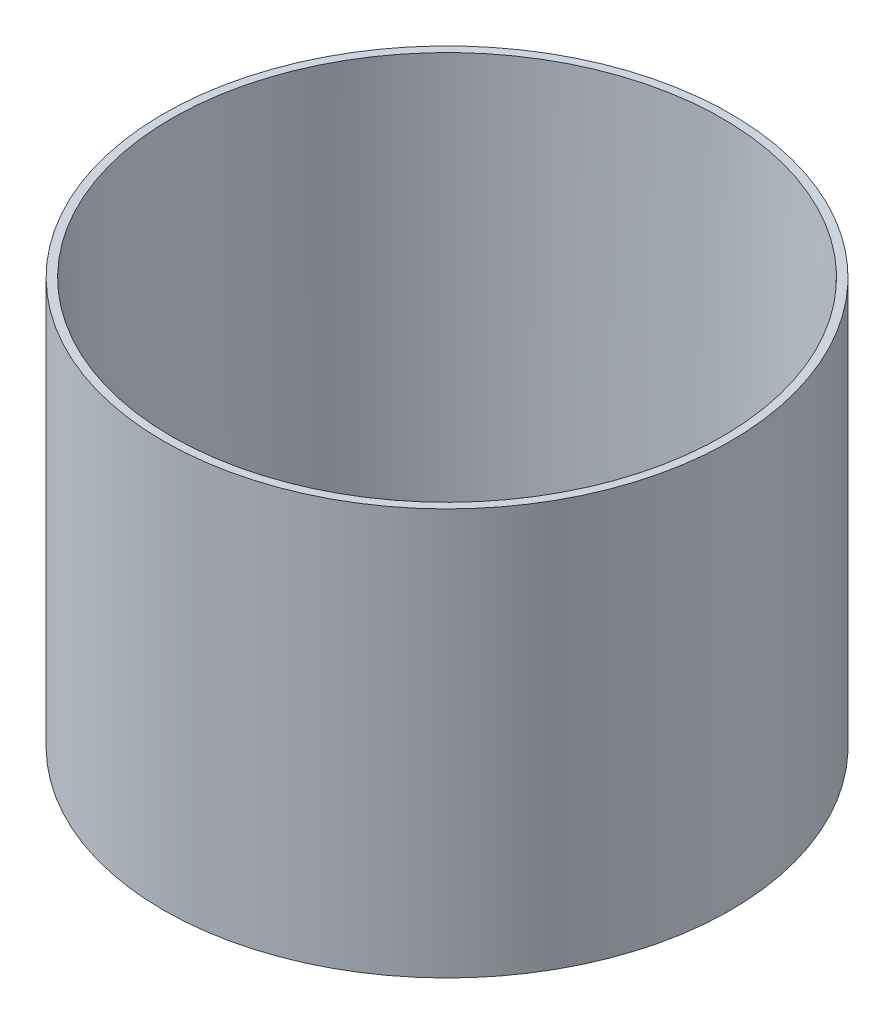
from build123d import *

# Parameters (mm, degrees)
SKETCH1_R           = 17.45
SKETCH1_R_2         = 16.25
BOSS_EXTRUDE1_DEPTH = 25
CHAMFER1_SIZE       = 25
CHAMFER1_SIZE_2     = 0.7


with BuildPart() as part:
    # Sketch1 → Boss-Extrude1 (new body)
    with BuildSketch(Plane(origin=(0, 0, 0), x_dir=(1, 0, 0), z_dir=(0, 1, 0))):
        with Locations(Location((0, 0, 0), (0, 0, 270))):
            Circle(SKETCH1_R)
        with Locations(Location((0, 0, 0), (0, 0, 270))):
            Circle(SKETCH1_R_2, mode=Mode.SUBTRACT)
    extrude(amount=BOSS_EXTRUDE1_DEPTH)

    # Chamfer1
    # the kernel refuses this chamfer: 25, 0.7 mm, written as the material it takes off along each edge
    with BuildSketch(Plane(origin=(0, 25, 0), x_dir=(0, 0, 1), z_dir=(-1, 0, 0))) as chamfer1_piece_1:
        Polygon((16.25, -CHAMFER1_SIZE), (16.25 + CHAMFER1_SIZE_2, 0), (16.25, 0), align=None)
    revolve(axis=Axis((0, 25, 0), (0, 1, 0)), mode=Mode.SUBTRACT)


solid = part.part
